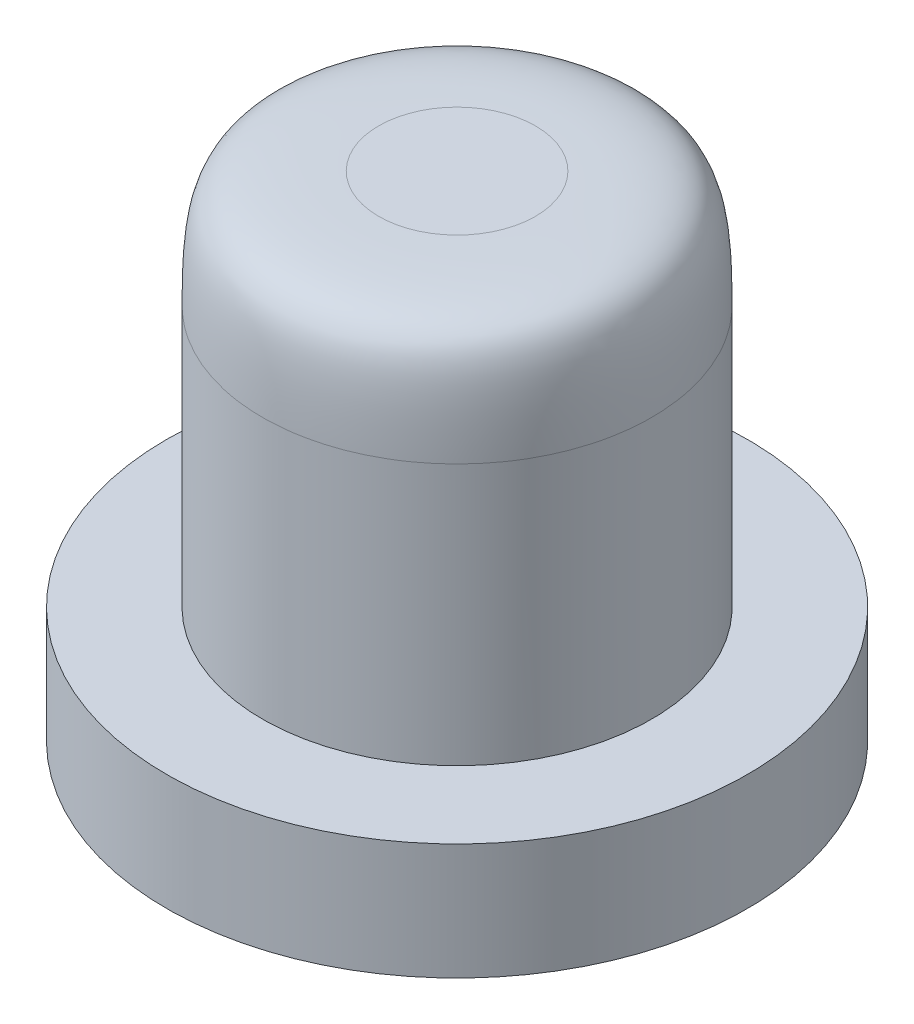
from build123d import *

# Parameters (mm, degrees)
CONG_1_SIZE = 2


with BuildPart() as part:
    # Esquisse1 → Révolution1 (revolve)
    with BuildSketch(Plane.XY, mode=Mode.PRIVATE) as r_volution1_sk:
        Polygon((0, 0), (5, 0), (5, 2), (3.35, 2), (3.35, 8.5), (0, 8.5), align=None)
    revolve(r_volution1_sk.sketch.rotate(Axis((0, 8.5, 0), (0, -1, 0)), 180), axis=Axis((0, 8.5, 0), (0, -1, 0)))

    # Congé1
    # a fillet whose section is not a circle: 2 mm, written as the material it takes off along each edge
    with BuildSketch(Plane(origin=(0, 8.5, 0), x_dir=(-1, 0, 0), z_dir=(0, 0, 1))) as cong_1_piece_1:
        with BuildLine():
            Bezier((3.35, CONG_1_SIZE), (3.35, 0), (3.35 - CONG_1_SIZE, 0), weights=[1, 2.333333333, 1])
            Line((3.35 - CONG_1_SIZE, 0), (3.35, 0))
            Line((3.35, 0), (3.35, CONG_1_SIZE))
        make_face()
    revolve(axis=Axis((0, 8.5, 0), (0, -1, 0)), mode=Mode.SUBTRACT)


solid = part.part
